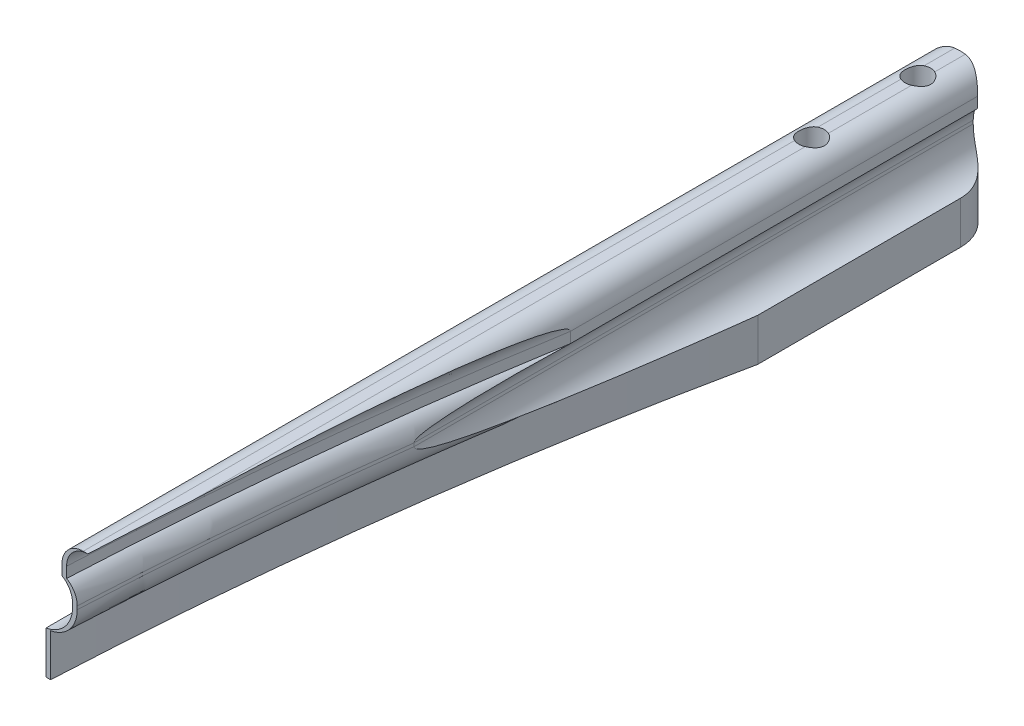
from build123d import *

# Parameters (mm, degrees)
SKETCH_1_W          = 4
SKETCH_1_H          = 17
SKETCH_1_H_2        = 8
EXTRUDE_1_DEPTH     = 4
SKETCH_1_7_W        = 44.5
SKETCH_1_7_H        = 8
EXTRUDE_2_DEPTH     = 3.5
SKETCH_2_W          = 18.5
SKETCH_2_H          = 1.5
CUT_EXTRUDE_1_DEPTH = 34.705526253
SKETCH_2_3_W        = 2.5
SKETCH_2_3_H        = 1.5
EXTRUDE_4_DEPTH     = 25
FILLET_1_R          = 1
FILLET_2_R          = 1.5
FILLET_3_R          = 1
SKETCH_10_W         = 4.5
SKETCH_10_H         = 8
SKETCH_10_W_2       = 36
SKETCH_10_H_2       = 50
CUT_EXTRUDE_2_DEPTH = 45.331845213
CUT_EXTRUDE_3_DEPTH = 43.252958476
SKETCH_12_W         = 4
SKETCH_12_H         = 50
CUT_EXTRUDE_4_DEPTH = 2
SKETCH_13_R         = 0.6
CUT_EXTRUDE_5_DEPTH = 42.920311452
SKETCH_24_R         = 0.6
CUT_EXTRUDE_6_DEPTH = 42.920311452
SKETCH_25_W         = 9.588346595
SKETCH_25_H         = 3.3
CUT_EXTRUDE_7_DEPTH = 42.920311452
SKETCH_26_W         = 7.846978632
SKETCH_26_H         = 7.676354821
CUT_EXTRUDE_8_DEPTH = 39.99618586


with BuildPart() as part:
    # 草图1 → 凸台-拉伸1 (new body)
    with BuildSketch(Plane(origin=(0, 0, 0), x_dir=(1, 0, 0), z_dir=(0, 1, 0))):
        with Locations((-15.75, -4)):
            Rectangle(SKETCH_1_W, SKETCH_1_H)
        with Locations((15.75, -4)):
            Rectangle(SKETCH_1_W, SKETCH_1_H)
        with Locations((15.75, 8.5)):
            Rectangle(SKETCH_1_W, SKETCH_1_H_2)
        with Locations((-15.75, 8.5)):
            Rectangle(SKETCH_1_W, SKETCH_1_H_2)
    extrude(amount=EXTRUDE_1_DEPTH)

    # 草图1<7> → 凸台-拉伸2 (add)
    with BuildSketch(Plane(origin=(0, 0, 0), x_dir=(1, 0, 0), z_dir=(0, 1, 0))):
        with Locations((0, 8.5)):
            Rectangle(SKETCH_1_7_W, SKETCH_1_7_H)
    extrude(amount=EXTRUDE_2_DEPTH)

    # 草图2 → 切除-拉伸1 (cut, through all)
    with BuildSketch(Plane(origin=(0, 0, -12.5), x_dir=(-1, 0, 0), z_dir=(0, 0, -1))):
        with Locations((0, 2.75)):
            Rectangle(SKETCH_2_W, SKETCH_2_H)
        Polygon((13.25, 3.5), (9.25, 3.5), (9.25, 2), align=None)
        Polygon((-9.25, 3.5), (-13.25, 3.5), (-9.25, 2), align=None)
        Polygon((-22.25, 3.5), (-22.25, 2), (-18.25, 3.5), align=None)
        Polygon((22.25, 3.5), (18.25, 3.5), (22.25, 2), align=None)
    extrude(amount=-CUT_EXTRUDE_1_DEPTH, mode=Mode.SUBTRACT)

    # 草图2<3> → 凸台-拉伸4 (add, through all)
    with BuildSketch(Plane(origin=(0, 0, -12.5), x_dir=(-1, 0, 0), z_dir=(0, 0, -1))):
        with Locations((-15.75, 7.25)):
            Rectangle(SKETCH_2_3_W, SKETCH_2_3_H)
        Polygon((-15, 6.5), (-16.5, 6.5), (-16.5, 4), (-15.75, 4), (-15, 4), align=None)
        with Locations((15.75, 7.25)):
            Rectangle(SKETCH_2_3_W, SKETCH_2_3_H)
        Polygon((16.5, 6.5), (15, 6.5), (15, 4), (15.75, 4), (16.5, 4), align=None)
    extrude(amount=-EXTRUDE_4_DEPTH)

    # 圆角1
    # the kernel refuses this fillet: 1 mm, written as the material it adds along each edge
    with BuildSketch(Plane(origin=(-16.5, 6.5, -12.5), x_dir=(-1, 0, 0), z_dir=(0, 0, 1)), Plane(origin=(15, 6.5, -12.5), x_dir=(-1, 0, 0), z_dir=(0, 0, 1))) as fillet_1_piece_1:
        with BuildLine():
            CenterArc((1, 0.866025404), FILLET_1_R, 180, 60)
            Line((0, 0.866025404), (-0.02, 0.866025404))
            Line((-0.02, 0.866025404), (-0.02, 0))
            Line((-0.02, 0), (0, -0.02))
            ThreePointArc((0, -0.02), (0.25, -0.02), (0.49, -0.017320508))
            Line((0.49, -0.017320508), (0.5, 0))
        make_face()
    extrude(amount=25)
    with BuildSketch(Plane(origin=(-15, 6.5, -12.5), x_dir=(0, -1, 0), z_dir=(0, 0, 1)), Plane(origin=(16.5, 6.5, -12.5), x_dir=(0, -1, 0), z_dir=(0, 0, 1))) as fillet_1_piece_2:
        with BuildLine():
            CenterArc((0.866025404, 1), FILLET_1_R, 210, 60)
            Line((0, 0.5), (-0.017320508, 0.49))
            ThreePointArc((-0.017320508, 0.49), (-0.02, 0.25), (-0.02, 0))
            Line((-0.02, 0), (0, -0.02))
            Line((0, -0.02), (0.866025404, -0.02))
            Line((0.866025404, -0.02), (0.866025404, 0))
        make_face()
    extrude(amount=25)

    # 圆角2
    # the kernel refuses this fillet: 1.5 mm, written as the material it adds along each edge
    with BuildSketch(Plane(origin=(16.5, 4, -12.5), x_dir=(1, 0, 0), z_dir=(0, 0, 1))) as fillet_2_piece_1:
        with BuildLine():
            CenterArc((1.5, 1.479019946), FILLET_2_R, 180, 80.405931773)
            Line((0, 1.479019946), (-0.03, 1.479019946))
            Line((-0.03, 1.479019946), (-0.03, 0))
            Line((-0.03, 0), (0, -0.03))
            ThreePointArc((0, -0.03), (0.625, -0.03), (1.245, -0.029580399))
            Line((1.245, -0.029580399), (1.25, 0))
        make_face()
    extrude(amount=25)
    with BuildSketch(Plane(origin=(15, 4, -12.5), x_dir=(0, 1, 0), z_dir=(0, 0, 1)), Plane(origin=(-16.5, 4, -12.5), x_dir=(0, 1, 0), z_dir=(0, 0, 1))) as fillet_2_piece_2:
        with BuildLine():
            CenterArc((1.479019946, 1.5), FILLET_2_R, 189.594068227, 80.405931773)
            Line((0, 1.25), (-0.029580399, 1.245))
            ThreePointArc((-0.029580399, 1.245), (-0.03, 0.625), (-0.03, 0))
            Line((-0.03, 0), (0, -0.03))
            Line((0, -0.03), (1.479019946, -0.03))
            Line((1.479019946, -0.03), (1.479019946, 0))
        make_face()
    extrude(amount=25)
    with BuildSketch(Plane(origin=(-15, 4, -12.5), x_dir=(0, 1, 0), z_dir=(0, 0, 1))) as fillet_2_piece_3:
        with BuildLine():
            CenterArc((1.479019946, -1.5), FILLET_2_R, 90, 80.405931773)
            Line((0, -1.25), (-0.029580399, -1.245))
            ThreePointArc((-0.029580399, -1.245), (-0.03, -0.625), (-0.03, 0))
            Line((-0.03, 0), (0, 0.03))
            Line((0, 0.03), (1.479019946, 0.03))
            Line((1.479019946, 0.03), (1.479019946, 0))
        make_face()
    extrude(amount=25)

    # 圆角3
    fillet_3_edges = [part.edges().sort_by_distance(p)[0] for p in [
        (14.5, 8, 0),
        (17, 8, 0),
        (-17, 8, 0),
        (-14.5, 8, 0),
    ]]
    fillet(fillet_3_edges, radius=FILLET_3_R)

    # 镜向2: part across plane


with BuildPart() as part_1:
    add(part.part)
    add(part.part.mirror(Plane(origin=(0, 4, 12.5), x_dir=(1, 0, 0), z_dir=(0, 0, -1))))

    # 草图10 → 切除-拉伸2 (cut, through all)
    with BuildSketch(Plane.XZ):
        with Locations((-20, 33.5)):
            Rectangle(SKETCH_10_W, SKETCH_10_H)
        with Locations((-20, -8.5)):
            Rectangle(SKETCH_10_W, SKETCH_10_H)
        with Locations((4.25, 12.5)):
            Rectangle(SKETCH_10_W_2, SKETCH_10_H_2)
    extrude(amount=-CUT_EXTRUDE_2_DEPTH, mode=Mode.SUBTRACT)

    # 草图11 → 切除-拉伸3 (cut, through all)
    with BuildSketch(Plane(origin=(0, 0, 0), x_dir=(-1, 0, 0), z_dir=(0, -1, 0))):
        with BuildLine():
            ThreePointArc((15.75, 12.5), (17.164213562, 11.914213562), (17.75, 10.5))
            Line((17.75, 10.5), (17.75, 12.5))
            Line((17.75, 12.5), (15.75, 12.5))
        make_face()
        with BuildLine():
            ThreePointArc((13.75, 10.5), (14.335786438, 11.914213562), (15.75, 12.5))
            Line((15.75, 12.5), (13.75, 12.5))
            Line((13.75, 12.5), (13.75, 10.5))
        make_face()
    extrude(amount=-CUT_EXTRUDE_3_DEPTH, mode=Mode.SUBTRACT)

    # 草图12 → 切除-拉伸4 (cut)
    with BuildSketch(Plane.XZ):
        with Locations((-15.75, 12.5)):
            Rectangle(SKETCH_12_W, SKETCH_12_H)
    extrude(amount=-CUT_EXTRUDE_4_DEPTH, mode=Mode.SUBTRACT)

    # 草图13 → 切除-拉伸5 (cut, through all)
    with BuildSketch(Plane(origin=(0, 8, 0), x_dir=(1, 0, 0), z_dir=(0, 1, 0))):
        with Locations(Location((-15.75, 10.5, 0), (0, 0, 270))):
            Circle(SKETCH_13_R)
    extrude(amount=-CUT_EXTRUDE_5_DEPTH, mode=Mode.SUBTRACT)

    # 草图16 → 切除-旋转1 (revolve, cut)
    with BuildSketch(Plane.XY.offset(37.5)):
        with BuildLine():
            Line((-17.75, 0), (-13.75, 0))
            Line((-13.75, 0), (-13.75, 4))
            ThreePointArc((-13.75, 4), (-14.645643924, 4.510774109), (-15, 5.479019946))
            Line((-15, 5.479019946), (-15, 5.633974596))
            ThreePointArc((-15, 5.633974596), (-14.866025404, 6.133974596), (-14.5, 6.5))
            Line((-14.5, 6.5), (-14.5, 7))
            ThreePointArc((-14.5, 7), (-14.792893219, 7.707106781), (-15.5, 8))
            Line((-15.5, 8), (-16, 8))
            ThreePointArc((-16, 8), (-16.707106781, 7.707106781), (-17, 7))
            Line((-17, 7), (-17, 6.5))
            ThreePointArc((-17, 6.5), (-16.633974596, 6.133974596), (-16.5, 5.633974596))
            Line((-16.5, 5.633974596), (-16.5, 5.479019946))
            ThreePointArc((-16.5, 5.479019946), (-16.854356076, 4.510774109), (-17.75, 4))
            Line((-17.75, 4), (-17.75, 0))
        make_face()
    revolve(axis=Axis((169.25, 37.729395322, 37.5), (0, -1, 0)), mode=Mode.SUBTRACT)

    # 草图24 → 切除-拉伸6 (cut, through all)
    with BuildSketch(Plane(origin=(0, 2, 0), x_dir=(-1, 0, 0), z_dir=(0, -1, 0))):
        with Locations(Location((15.75, 5.5, 0), (0, 0, 90))):
            Circle(SKETCH_24_R)
    extrude(amount=-CUT_EXTRUDE_6_DEPTH, mode=Mode.SUBTRACT)

    # 草图25 → 切除-拉伸7 (cut, through all)
    with BuildSketch(Plane(origin=(0, 8, 0), x_dir=(1, 0, 0), z_dir=(0, 1, 0))):
        with Locations((-13.334902889, -35.85)):
            Rectangle(SKETCH_25_W, SKETCH_25_H)
    extrude(amount=-CUT_EXTRUDE_7_DEPTH, mode=Mode.SUBTRACT)

    # 草图26 → 切除-拉伸8 (cut, through all)
    with BuildSketch(Plane(origin=(0, 8, 0), x_dir=(1, 0, 0), z_dir=(0, 1, 0))):
        with Locations((-16.033810668, -32.338177411)):
            Rectangle(SKETCH_26_W, SKETCH_26_H)
    extrude(amount=-CUT_EXTRUDE_8_DEPTH, mode=Mode.SUBTRACT)


solid = part_1.part
